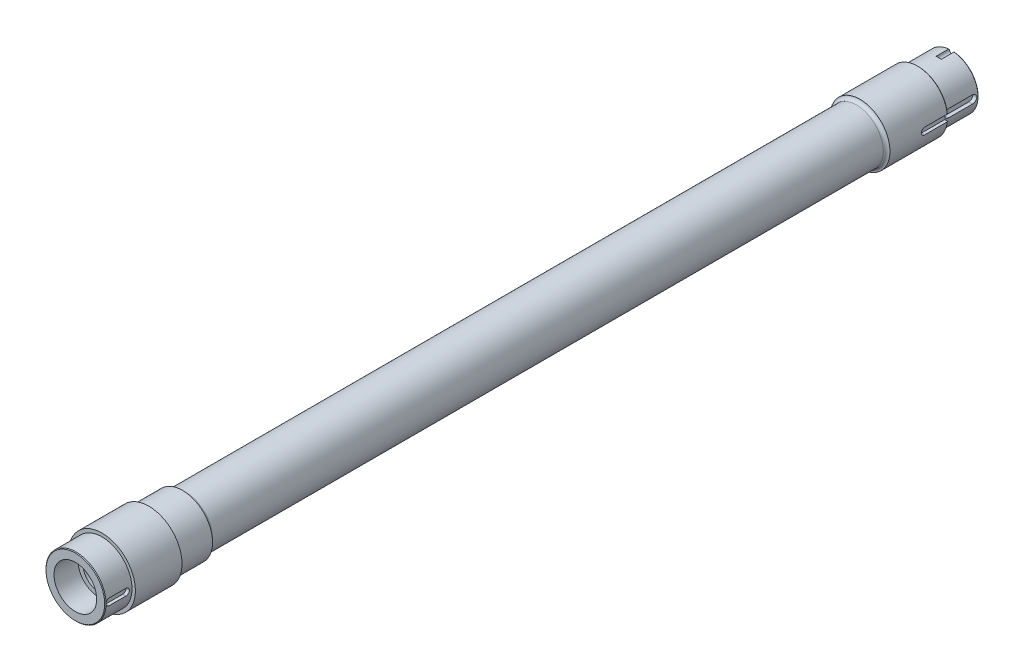
from build123d import *

# Parameters (mm, degrees)
CHAMFER_1_SIZE      = 0.5
CUT_EXTRUDE_3_DEPTH = 10
CUT_EXTRUDE_4_DEPTH = 10
CUT_EXTRUDE_5_DEPTH = 10
SKETCH_6_R          = 2
CUT_EXTRUDE_7_DEPTH = 10


with BuildPart() as part:
    # 草图1 → 旋转1 (revolve)
    with BuildSketch(Plane(origin=(0, 0, 0), x_dir=(0, 0, -1), z_dir=(1, 0, 0))):
        with BuildLine():
            Line((0, 0), (0, 22.5))
            Line((0, 22.5), (20, 22.5))
            Line((20, 22.5), (20, 25))
            Line((20, 25), (55, 25))
            Line((55, 25), (55, 22.5))
            Line((55, 22.5), (80.4, 22.5))
            ThreePointArc((80.4, 22.5), (81.132233047, 20.732233047), (82.9, 20))
            Line((82.9, 20), (585.8, 20))
            ThreePointArc((585.8, 20), (587.567766953, 20.732233047), (588.3, 22.5))
            Line((588.3, 22.5), (631.9, 22.5))
            Line((631.9, 22.5), (631.9, 20))
            Line((631.9, 20), (657.3, 20))
            Line((657.3, 20), (657.3, 0))
            Line((657.3, 0), (0, 0))
        make_face()
    revolve(axis=Axis((0, 0, 0), (0, 0, 1)))

    # 草图2 → 切除-旋转1 (revolve, cut)
    with BuildSketch(Plane(origin=(0, 0, 0), x_dir=(0, 0, -1), z_dir=(1, 0, 0))):
        Polygon((0, 0), (0, 16), (18, 16), (18, 12.5), (643.3, 12.5), (643.3, 14), (657.3, 14), (657.3, 0), align=None)
    revolve(axis=Axis((0, 0, 0), (0, 0, -1)), mode=Mode.SUBTRACT)

    # 倒角1
    chamfer_1_edges = [part.edges().sort_by_distance(p)[0] for p in [
        (0, -14, -657.3),
        (0, -20, -657.3),
        (0, -22.5, -631.9),
        (0, -22.5, 0),
    ]]
    chamfer(chamfer_1_edges, length=CHAMFER_1_SIZE)

    # 草图3 → 切除-拉伸3 (cut)
    with BuildSketch(Plane(origin=(20, 0, 0), x_dir=(0, 0, -1), z_dir=(1, 0, 0))):
        with BuildLine():
            Line((3, 2.5), (15.5, 2.5))
            ThreePointArc((15.5, 2.5), (18, 0), (15.5, -2.5))
            Line((15.5, -2.5), (3, -2.5))
            ThreePointArc((3, -2.5), (0.5, 0), (3, 2.5))
        make_face()
    cut_extrude_3 = extrude(amount=CUT_EXTRUDE_3_DEPTH, mode=Mode.SUBTRACT)

    # 草图4 → 切除-拉伸4 (cut)
    with BuildSketch(Plane(origin=(20, 0, 0), x_dir=(0, 0, -1), z_dir=(1, 0, 0))):
        with BuildLine():
            Line((631.9, 2.5), (614.4, 2.5))
            ThreePointArc((614.4, 2.5), (611.9, 0), (614.4, -2.5))
            Line((614.4, -2.5), (631.9, -2.5))
            Line((631.9, -2.5), (631.9, 2.5))
        make_face()
    extrude(amount=CUT_EXTRUDE_4_DEPTH, mode=Mode.SUBTRACT)

    # 草图5 → 切除-拉伸5 (cut)
    with BuildSketch(Plane(origin=(17, 0, 0), x_dir=(0, 0, -1), z_dir=(1, 0, 0))):
        with BuildLine():
            Line((634.9, 3), (652.9, 3))
            ThreePointArc((652.9, 3), (655.9, 0), (652.9, -3))
            Line((652.9, -3), (634.9, -3))
            ThreePointArc((634.9, -3), (631.9, 0), (634.9, 3))
        make_face()
    cut_extrude_5 = extrude(amount=CUT_EXTRUDE_5_DEPTH, mode=Mode.SUBTRACT)

    # 镜向1: 切除-拉伸3, 切除-拉伸5 across plane
    add(cut_extrude_3.mirror(Plane(origin=(0, 0, 0), x_dir=(0, 0, 1), z_dir=(1, 0, 0))), mode=Mode.SUBTRACT)
    add(cut_extrude_5.mirror(Plane(origin=(0, 0, 0), x_dir=(0, 0, 1), z_dir=(1, 0, 0))), mode=Mode.SUBTRACT)

    # 草图6 → 切除-拉伸7 (cut)
    with BuildSketch(Plane.XY.offset(-657.3)):
        with Locations((0, 19.5)):
            Circle(SKETCH_6_R)
        with Locations((0, -19.5)):
            Circle(SKETCH_6_R)
    extrude(amount=CUT_EXTRUDE_7_DEPTH, mode=Mode.SUBTRACT)


solid = part.part
